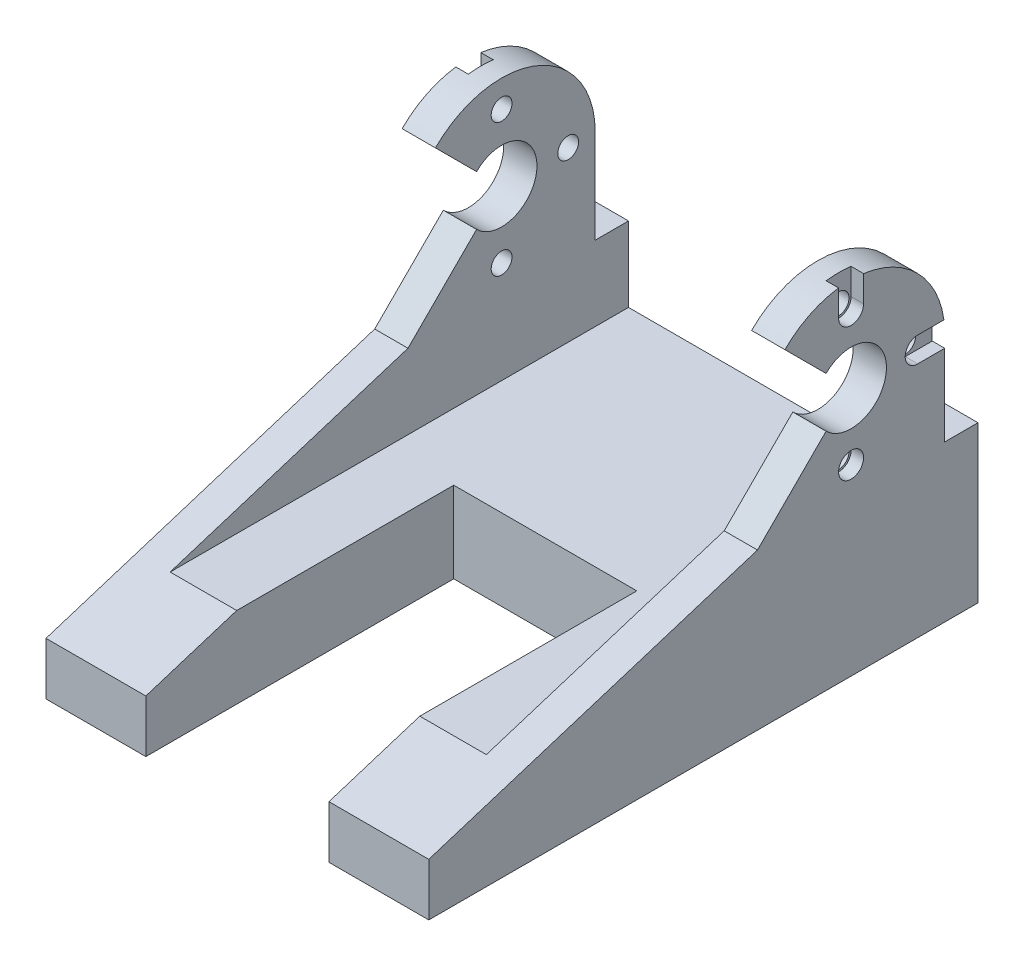
from build123d import *

# Parameters (mm, degrees)
SKETCH1_W                = 50
SKETCH1_H                = 170
BOSS_EXTRUDE1_DEPTH      = 55
SKETCH2_W                = 34
SKETCH2_H                = 27
CUT_EXTRUDE1_DEPTH       = 181.416185527
SKETCH3_W                = 10
SKETCH3_H                = 24
SKETCH3_R                = 4.25
SKETCH3_R_2              = 1
CUT_EXTRUDE2_DEPTH       = 186.539753153
SKETCH4_W                = 2
SKETCH4_H                = 24
CUT_EXTRUDE3_DEPTH       = 178.623196683
SKETCH5_W                = 6.25
SKETCH5_H                = 11.25
CUT_EXTRUDE4_DEPTH       = 186.539753153
SKETCH6_W                = 38
SKETCH6_H                = 10
CUT_EXTRUDE5_DEPTH       = 181.416185527
SKETCH8_W                = 13.25
SKETCH8_H                = 2.25
CUT_EXTRUDE7_DEPTH       = 186.539753153
SKETCH9_W                = 34
SKETCH9_H                = 35.25
CUT_EXTRUDE8_DEPTH       = 179.297679458
SKETCH11_W               = 13.25
SKETCH11_H               = 20.25
CUT_EXTRUDE9_DEPTH       = 184.480414486
SKETCH12_W               = 28.5
SKETCH12_H               = 15
BOSS_EXTRUDE2_DEPTH      = 8
SKETCH14_W               = 34
SKETCH14_H               = 15
SKETCH14_H_2             = 10.25
BOSS_EXTRUDE3_DEPTH      = 13.25
SKETCH16_R               = 4.5
SKETCH16_R_2             = 2.5
CUT_EXTRUDE13_DEPTH      = 8
SKETCH17_R               = 4.5
SKETCH17_W               = 55
SKETCH17_H               = 10.25
CUT_EXTRUDE15_DEPTH      = 175.384811552
SKETCH18_W               = 71.25
SKETCH18_H               = 27.5
SKETCH18_W_2             = 13.75
SKETCH18_W_3             = 16.25
BOSS_EXTRUDE4_DEPTH      = 50
SKETCH19_W               = 38
SKETCH19_H               = 7
CUT_EXTRUDE16_DEPTH      = 152.25227271
SKETCH20_W               = 57.5
SKETCH20_H               = 27.5
CUT_EXTRUDE17_DEPTH      = 102.137591923
CUT_EXTRUDE18_DEPTH      = 100.39221549
SKETCH22_W               = 82.5
SKETCH22_H               = 2.5
BOSS_EXTRUDE5_DEPTH      = 50
SKETCH24_W               = 22
SKETCH24_H               = 17
CUT_EXTRUDE19_DEPTH      = 101.710289941
SKETCH25_W               = 38
SKETCH25_H               = 38.136363636
CUT_EXTRUDE20_DEPTH      = 10
SKETCH27_W               = 38
SKETCH27_H               = 60.136363636
BOSS_EXTRUDE6_DEPTH      = 8.6
SKETCH29_W               = 38
SKETCH29_H               = 1.4
CUT_EXTRUDE21_DEPTH      = 85.601313414
BOSS_EXTRUDE7_DEPTH      = 50
SKETCH31_W               = 38
SKETCH31_H               = 17
CUT_EXTRUDE22_DEPTH      = 117.365802537
SKETCH32_W               = 100
SKETCH32_H               = 3
CUT_EXTRUDE23_DEPTH      = 101.710289941
SKETCH33_W               = 20
SKETCH33_H               = 10
SKETCH33_W_2             = 22
SKETCH33_H_2             = 45
CUT_EXTRUDE24_DEPTH      = 84.137311118
SKETCH34_W               = 8
SKETCH34_H               = 12
CUT_EXTRUDE25_DEPTH      = 76.0787087
BOSS_EXTRUDE8_DEPTH      = 8
SKETCH37_W               = 78
SKETCH37_H               = 9
SKETCH37_W_2             = 12
CUT_EXTRUDE27_DEPTH      = 93.48006542
FILLET1_R                = 10
CUT_EXTRUDE29_DEPTH      = 77.423572934
CUT_EXTRUDE29_DEPTH_BACK = 77.423572934
SKETCH38_W               = 2
SKETCH38_H               = 78
SKETCH38_W_2             = 46
SKETCH38_H_2             = 8
SKETCH39_W               = 22.223383748
SKETCH39_H               = 19.441332461
CUT_EXTRUDE30_DEPTH      = 86.624543794
BOSS_EXTRUDE9_DEPTH      = 0.75
CUT_EXTRUDE31_DEPTH      = 76.967920861
SKETCH44_R               = 1.25
CUT_EXTRUDE32_DEPTH      = 76.967920861
SKETCH45_R               = 1.25
SKETCH45_R_2             = 1.5
CUT_EXTRUDE33_DEPTH      = 1.5


with BuildPart() as part:
    # Sketch1 → Boss-Extrude1 (new body)
    with BuildSketch(Plane.XY):
        with Locations((0, -85)):
            Rectangle(SKETCH1_W, SKETCH1_H)
    extrude(amount=-BOSS_EXTRUDE1_DEPTH)

    # Sketch2 → Cut-Extrude1 (cut, through all)
    with BuildSketch(Plane.XY):
        with Locations((0, -13.5)):
            Rectangle(SKETCH2_W, SKETCH2_H)
    extrude(amount=-CUT_EXTRUDE1_DEPTH, mode=Mode.SUBTRACT)

    # Sketch3 → Cut-Extrude2 (cut, through all)
    with BuildSketch(Plane(origin=(25, 0, 0), x_dir=(0, 0, -1), z_dir=(1, 0, 0))):
        with Locations((50, -12)):
            Rectangle(SKETCH3_W, SKETCH3_H)
        with Locations((5, -12)):
            Rectangle(SKETCH3_W, SKETCH3_H)
        with Locations(Location((27.5, -12.75, 0), (0, 0, 90))):
            Circle(SKETCH3_R)
        with Locations(Location((35.5, -12.75, 0), (0, 0, 90))):
            Circle(SKETCH3_R_2)
        with Locations(Location((27.5, -4.75, 0), (0, 0, 90))):
            Circle(SKETCH3_R_2)
        with Locations(Location((27.5, -20.75, 0), (0, 0, 90))):
            Circle(SKETCH3_R_2)
        with Locations(Location((19.5, -12.75, 0), (0, 0, 90))):
            Circle(SKETCH3_R_2)
    extrude(amount=-CUT_EXTRUDE2_DEPTH, mode=Mode.SUBTRACT)

    # Sketch4 → Cut-Extrude3 (cut, through all)
    with BuildSketch(Plane.XY.offset(-10)):
        with Locations((-18, -12)):
            Rectangle(SKETCH4_W, SKETCH4_H)
        with Locations((18, -12)):
            Rectangle(SKETCH4_W, SKETCH4_H)
    extrude(amount=-CUT_EXTRUDE3_DEPTH, mode=Mode.SUBTRACT)

    # Sketch5 → Cut-Extrude4 (cut, through all)
    with BuildSketch(Plane(origin=(25, 0, 0), x_dir=(0, 0, -1), z_dir=(1, 0, 0))):
        with BuildLine():
            Line((45, 0), (10, 0))
            Line((10, 0), (10, -12.75))
            Line((10, -12.75), (16.25, -12.75))
            ThreePointArc((16.25, -12.75), (27.5, -1.5), (38.75, -12.75))
            Line((38.75, -12.75), (45, -12.75))
            Line((45, -12.75), (45, 0))
        make_face()
        with Locations((13.125, -18.375)):
            Rectangle(SKETCH5_W, SKETCH5_H)
        with Locations((41.875, -18.375)):
            Rectangle(SKETCH5_W, SKETCH5_H)
    extrude(amount=-CUT_EXTRUDE4_DEPTH, mode=Mode.SUBTRACT)

    # Sketch6 → Cut-Extrude5 (cut, through all)
    with BuildSketch(Plane.XY):
        with Locations((0, -29)):
            Rectangle(SKETCH6_W, SKETCH6_H)
    extrude(amount=-CUT_EXTRUDE5_DEPTH, mode=Mode.SUBTRACT)

    # Sketch8 → Cut-Extrude7 (cut, through all)
    with BuildSketch(Plane(origin=(25, 0, 0), x_dir=(0, 0, -1), z_dir=(1, 0, 0))):
        with BuildLine():
            Line((27.5, -157.5), (27.5, -132.5))
            Line((27.5, -132.5), (13.25, -132.5))
            Line((13.25, -132.5), (13.25, -167.75))
            Line((13.25, -167.75), (17.25, -167.75))
            ThreePointArc((17.25, -167.75), (20.252155493, -160.502155493), (27.5, -157.5))
        make_face()
        with BuildLine():
            Line((41.75, -167.75), (41.75, -132.5))
            Line((41.75, -132.5), (27.5, -132.5))
            Line((27.5, -132.5), (27.5, -157.5))
            ThreePointArc((27.5, -157.5), (34.747844507, -160.502155493), (37.75, -167.75))
            Line((37.75, -167.75), (41.75, -167.75))
        make_face()
        with Locations((48.375, -168.875)):
            Rectangle(SKETCH8_W, SKETCH8_H)
        with Locations((6.625, -168.875)):
            Rectangle(SKETCH8_W, SKETCH8_H)
        with BuildLine():
            Line((17.25, -167.75), (13.25, -167.75))
            Line((13.25, -167.75), (13.25, -170))
            Line((13.25, -170), (17.5, -170))
            ThreePointArc((17.5, -170), (17.31269172, -168.881923142), (17.25, -167.75))
        make_face()
        with BuildLine():
            Line((41.75, -170), (41.75, -167.75))
            Line((41.75, -167.75), (37.75, -167.75))
            ThreePointArc((37.75, -167.75), (37.68730828, -168.881923142), (37.5, -170))
            Line((37.5, -170), (41.75, -170))
        make_face()
        with BuildLine():
            Line((27.5, -167.75), (27.5, -157.5))
            ThreePointArc((27.5, -157.5), (20.252155493, -160.502155493), (17.25, -167.75))
            Line((17.25, -167.75), (27.5, -167.75))
        make_face()
        with BuildLine():
            ThreePointArc((37.75, -167.75), (34.747844507, -160.502155493), (27.5, -157.5))
            Line((27.5, -157.5), (27.5, -167.75))
            Line((27.5, -167.75), (37.75, -167.75))
        make_face()
        with BuildLine():
            Line((27.5, -170), (27.5, -167.75))
            Line((27.5, -167.75), (17.25, -167.75))
            ThreePointArc((17.25, -167.75), (17.31269172, -168.881923142), (17.5, -170))
            Line((17.5, -170), (27.5, -170))
        make_face()
        with BuildLine():
            ThreePointArc((37.5, -170), (37.68730828, -168.881923142), (37.75, -167.75))
            Line((37.75, -167.75), (27.5, -167.75))
            Line((27.5, -167.75), (27.5, -170))
            Line((27.5, -170), (37.5, -170))
        make_face()
    extrude(amount=-CUT_EXTRUDE7_DEPTH, mode=Mode.SUBTRACT)

    # Sketch9 → Cut-Extrude8 (cut, through all)
    with BuildSketch(Plane.XY):
        with Locations((0, -150.125)):
            Rectangle(SKETCH9_W, SKETCH9_H)
    extrude(amount=-CUT_EXTRUDE8_DEPTH, mode=Mode.SUBTRACT)

    # Sketch11 → Cut-Extrude9 (cut, through all)
    with BuildSketch(Plane(origin=(25, 0, 0), x_dir=(0, 0, -1), z_dir=(1, 0, 0))):
        with BuildLine():
            ThreePointArc((17.25, -167.75), (20.252155493, -160.502155493), (27.5, -157.5))
            Line((27.5, -157.5), (27.5, -147.5))
            Line((27.5, -147.5), (13.25, -147.5))
            Line((13.25, -147.5), (13.25, -167.75))
            Line((13.25, -167.75), (17.25, -167.75))
        make_face()
        with BuildLine():
            Line((27.5, -147.5), (27.5, -157.5))
            ThreePointArc((27.5, -157.5), (34.747844507, -160.502155493), (37.75, -167.75))
            Line((37.75, -167.75), (41.75, -167.75))
            Line((41.75, -167.75), (41.75, -147.5))
            Line((41.75, -147.5), (27.5, -147.5))
        make_face()
        with Locations((48.375, -157.625)):
            Rectangle(SKETCH11_W, SKETCH11_H)
        with Locations((6.625, -157.625)):
            Rectangle(SKETCH11_W, SKETCH11_H)
    extrude(amount=-CUT_EXTRUDE9_DEPTH, mode=Mode.SUBTRACT)

    # Sketch12 → Boss-Extrude2 (add)
    with BuildSketch(Plane(origin=(25, 0, 0), x_dir=(0, 0, -1), z_dir=(1, 0, 0))):
        with Locations((27.5, -140)):
            Rectangle(SKETCH12_W, SKETCH12_H)
    boss_extrude2 = extrude(amount=-BOSS_EXTRUDE2_DEPTH)

    # Mirror1: Boss-Extrude2 across plane
    add(boss_extrude2.mirror(Plane(origin=(0, 0, 0), x_dir=(0, 0, 1), z_dir=(1, 0, 0))))

    # Sketch14 → Boss-Extrude3 (add)
    with BuildSketch(Plane.XY):
        with Locations((0, -140)):
            Rectangle(SKETCH14_W, SKETCH14_H)
        with Locations((0, -152.625)):
            Rectangle(SKETCH14_W, SKETCH14_H_2)
    boss_extrude3 = extrude(amount=-BOSS_EXTRUDE3_DEPTH)

    # Mirror2: Boss-Extrude3 across plane
    add(boss_extrude3.mirror(Plane.XY.offset(-27.5)))

    # Sketch16 → Cut-Extrude13 (cut)
    # profile 1 of 3: a face of its own
    with BuildSketch(Plane(origin=(25, 0, 0), x_dir=(0, 0, -1), z_dir=(1, 0, 0))):
        with Locations(Location((16.5, -135.75, 0), (0, 0, 90))):
            Circle(SKETCH16_R)
        with Locations((16.5, -135.75)):
            Circle(SKETCH16_R_2, mode=Mode.SUBTRACT)
    # profile 2 of 3: a face of its own
    with BuildSketch(Plane(origin=(25, 0, 0), x_dir=(0, 0, -1), z_dir=(1, 0, 0))):
        with Locations((16.5, -135.75)):
            Circle(SKETCH16_R_2)
    # profile 3 of 3: a face of its own
    with BuildSketch(Plane(origin=(25, 0, 0), x_dir=(0, 0, -1), z_dir=(1, 0, 0))):
        with Locations(Location((38.5, -135.75, 0), (0, 0, 90))):
            Circle(SKETCH16_R)
    cut_extrude13 = extrude(amount=-CUT_EXTRUDE13_DEPTH, mode=Mode.SUBTRACT)

    # Mirror3: Cut-Extrude13 across plane
    add(cut_extrude13.mirror(Plane(origin=(0, 0, 0), x_dir=(0, 0, 1), z_dir=(1, 0, 0))), mode=Mode.SUBTRACT)

    # Sketch17 → Cut-Extrude15 (cut, through all)
    # profile 1 of 4: a face of its own
    with BuildSketch(Plane(origin=(25, 0, 0), x_dir=(0, 0, -1), z_dir=(1, 0, 0))):
        Polygon((55, -51.5), (27.5, -51.5), (0, -51.5), (0, -147.5), (55, -147.5), align=None)
        with Locations((16.5, -135.75)):
            Circle(SKETCH17_R, mode=Mode.SUBTRACT)
        with Locations((38.5, -135.75)):
            Circle(SKETCH17_R, mode=Mode.SUBTRACT)
    # profile 2 of 4: a face of its own
    with BuildSketch(Plane(origin=(25, 0, 0), x_dir=(0, 0, -1), z_dir=(1, 0, 0))):
        with Locations((27.5, -152.625)):
            Rectangle(SKETCH17_W, SKETCH17_H)
    # profile 3 of 4: a face of its own
    with BuildSketch(Plane(origin=(25, 0, 0), x_dir=(0, 0, -1), z_dir=(1, 0, 0))):
        with Locations((38.5, -135.75)):
            Circle(SKETCH17_R)
    # profile 4 of 4: a face of its own
    with BuildSketch(Plane(origin=(25, 0, 0), x_dir=(0, 0, -1), z_dir=(1, 0, 0))):
        with Locations((16.5, -135.75)):
            Circle(SKETCH17_R)
    extrude(amount=-CUT_EXTRUDE15_DEPTH, mode=Mode.SUBTRACT)

    # Sketch18 → Boss-Extrude4 (add)
    with BuildSketch(Plane(origin=(25, 0, 0), x_dir=(0, 0, -1), z_dir=(1, 0, 0))):
        with Locations((-35.625, -37.75)):
            Rectangle(SKETCH18_W, SKETCH18_H)
        with Locations((61.875, -37.75)):
            Rectangle(SKETCH18_W_2, SKETCH18_H)
        Polygon((38.75, -51.5), (38.75, -24), (16.25, -24), (0, -24), (0, -51.5), align=None)
        with Locations((46.875, -37.75)):
            Rectangle(SKETCH18_W_3, SKETCH18_H)
    extrude(amount=-BOSS_EXTRUDE4_DEPTH)

    # Sketch19 → Cut-Extrude16 (cut, through all)
    with BuildSketch(Plane.XY.offset(71.25)):
        with Locations((0, -27.5)):
            Rectangle(SKETCH19_W, SKETCH19_H)
    extrude(amount=-CUT_EXTRUDE16_DEPTH, mode=Mode.SUBTRACT)

    # Sketch20 → Cut-Extrude17 (cut, through all)
    with BuildSketch(Plane(origin=(25, 0, 0), x_dir=(0, 0, -1), z_dir=(1, 0, 0))):
        with Locations((-42.5, -37.75)):
            Rectangle(SKETCH20_W, SKETCH20_H)
    extrude(amount=-CUT_EXTRUDE17_DEPTH, mode=Mode.SUBTRACT)

    # Sketch21 → Cut-Extrude18 (cut, through all)
    with BuildSketch(Plane(origin=(25, 0, 0), x_dir=(0, 0, -1), z_dir=(1, 0, 0))):
        Polygon((16.25, -24), (-13.75, -51.5), (-13.75, -24), align=None)
    extrude(amount=-CUT_EXTRUDE18_DEPTH, mode=Mode.SUBTRACT)

    # Sketch22 → Boss-Extrude5 (add)
    with BuildSketch(Plane(origin=(25, 0, 0), x_dir=(0, 0, -1), z_dir=(1, 0, 0))):
        with Locations((27.5, -52.75)):
            Rectangle(SKETCH22_W, SKETCH22_H)
    extrude(amount=-BOSS_EXTRUDE5_DEPTH)

    # Sketch24 → Cut-Extrude19 (cut, through all)
    with BuildSketch(Plane(origin=(25, 0, 0), x_dir=(0, 0, -1), z_dir=(1, 0, 0))):
        with Locations((57.75, -32.5)):
            Rectangle(SKETCH24_W, SKETCH24_H)
    extrude(amount=-CUT_EXTRUDE19_DEPTH, mode=Mode.SUBTRACT)

    # Sketch25 → Cut-Extrude20 (cut)
    with BuildSketch(Plane(origin=(0, -31, 0), x_dir=(1, 0, 0), z_dir=(0, 1, 0))):
        with Locations((0, 27.681818182)):
            Rectangle(SKETCH25_W, SKETCH25_H)
    extrude(amount=-CUT_EXTRUDE20_DEPTH, mode=Mode.SUBTRACT)

    # Sketch27 → Boss-Extrude6 (add)
    with BuildSketch(Plane(origin=(0, -41, 0), x_dir=(1, 0, 0), z_dir=(0, 1, 0))):
        with Locations((0, 38.681818182)):
            Rectangle(SKETCH27_W, SKETCH27_H)
    extrude(amount=BOSS_EXTRUDE6_DEPTH)

    # Sketch29 → Cut-Extrude21 (cut, through all)
    with BuildSketch(Plane(origin=(0, 0, -8.613636364), x_dir=(-1, 0, 0), z_dir=(0, 0, -1))):
        with Locations((0, -31.7)):
            Rectangle(SKETCH29_W, SKETCH29_H)
    extrude(amount=-CUT_EXTRUDE21_DEPTH, mode=Mode.SUBTRACT)

    # Sketch30 → Boss-Extrude7 (add)
    with BuildSketch(Plane.ZY.offset(25)):
        Polygon((31.25, -38.957214173), (-16.25, -24), (-7.086363636, -32.4), (13.75, -51.5), (13.75, -53.914428346), (31.25, -53.914428346), align=None)
        Polygon((-16.25, -24), (-16.25, -32.4), (-7.086363636, -32.4), align=None)
    extrude(amount=-BOSS_EXTRUDE7_DEPTH)

    # Sketch31 → Cut-Extrude22 (cut, through all)
    with BuildSketch(Plane(origin=(0, 0, -68.75), x_dir=(-1, 0, 0), z_dir=(0, 0, -1))):
        with Locations((0, -32.5)):
            Rectangle(SKETCH31_W, SKETCH31_H)
    extrude(amount=-CUT_EXTRUDE22_DEPTH, mode=Mode.SUBTRACT)

    # Sketch32 → Cut-Extrude23 (cut, through all)
    with BuildSketch(Plane(origin=(25, 0, 0), x_dir=(0, 0, -1), z_dir=(1, 0, 0))):
        with Locations((18.75, -52.5)):
            Rectangle(SKETCH32_W, SKETCH32_H)
    extrude(amount=-CUT_EXTRUDE23_DEPTH, mode=Mode.SUBTRACT)

    # Sketch33 → Cut-Extrude24 (cut, through all)
    with BuildSketch(Plane(origin=(0, -41, 0), x_dir=(1, 0, 0), z_dir=(0, 1, 0))):
        Polygon((-10, 68.75), (-25, 68.75), (-25, 46.75), (-19, 46.75), (-10, 46.75), (-10, 58.75), align=None)
        Polygon((25, 68.75), (10, 68.75), (10, 58.75), (10, 46.75), (19, 46.75), (25, 46.75), align=None)
        with Locations((0, 63.75)):
            Rectangle(SKETCH33_W, SKETCH33_H)
        with Locations((0, -8.75)):
            Rectangle(SKETCH33_W_2, SKETCH33_H_2)
    extrude(amount=-CUT_EXTRUDE24_DEPTH, mode=Mode.SUBTRACT)

    # Sketch34 → Cut-Extrude25 (cut, through all)
    with BuildSketch(Plane(origin=(0, -41, 0), x_dir=(1, 0, 0), z_dir=(0, 1, 0))):
        with Locations((0, 52.75)):
            Rectangle(SKETCH34_W, SKETCH34_H)
    extrude(amount=-CUT_EXTRUDE25_DEPTH, mode=Mode.SUBTRACT)

    # Sketch36 → Boss-Extrude8 (add)
    with BuildSketch(Plane(origin=(0, -41, 0), x_dir=(1, 0, 0), z_dir=(0, 1, 0))):
        Polygon((4, 58.75), (4, 46.75), (-4, 46.75), (-4, 58.75), (-10, 58.75), (-10, 46.75), (-19, 46.75), (-19, -31.25), (-11, -31.25), (-11, 13.75), (11, 13.75), (11, -31.25), (19, -31.25), (19, 46.75), (10, 46.75), (10, 58.75), align=None)
    extrude(amount=BOSS_EXTRUDE8_DEPTH)

    # Sketch37 → Cut-Extrude27 (cut, through all)
    with BuildSketch(Plane(origin=(25, 0, 0), x_dir=(0, 0, -1), z_dir=(1, 0, 0))):
        with Locations((7.75, -46.5)):
            Rectangle(SKETCH37_W, SKETCH37_H)
        Polygon((-31.25, -33), (-31.25, -38.957214173), (-12.331525614, -33), align=None)
        with Locations((52.75, -46.5)):
            Rectangle(SKETCH37_W_2, SKETCH37_H)
    extrude(amount=-CUT_EXTRUDE27_DEPTH, mode=Mode.SUBTRACT)

    # Fillet1
    # the kernel refuses this fillet: 10 mm, written as the material it takes off along each edge
    with BuildSketch(Plane(origin=(20.874685928, -42, -58.75), x_dir=(0, 0, 1), z_dir=(-1, 0, 0)), Plane(origin=(34.874685928, -42, -58.75), x_dir=(0, 0, 1), z_dir=(-1, 0, 0))) as fillet1_piece_1:
        with BuildLine():
            CenterArc((9.949874371, 10), FILLET1_R, 185.739170477, 84.260829523)
            Line((0, 9), (-0.198997487, 8.98))
            ThreePointArc((-0.198997487, 8.98), (-0.2, 4.5), (-0.2, 0))
            Line((-0.2, 0), (0, -0.2))
            Line((0, -0.2), (9.949874371, -0.2))
            Line((9.949874371, -0.2), (9.949874371, 0))
        make_face()
    extrude(amount=55.749371855, mode=Mode.SUBTRACT)

    # Sketch38 → Cut-Extrude29 (cut, two sides: drawn at the far end of the back side and taken through both)
    with BuildSketch(Plane(origin=(0, 0, 0), x_dir=(1, 0, 0), z_dir=(0, 1, 0)).offset(-CUT_EXTRUDE29_DEPTH_BACK)):
        with Locations((-24, 7.75)):
            Rectangle(SKETCH38_W, SKETCH38_H)
        with Locations((24, 7.75)):
            Rectangle(SKETCH38_W, SKETCH38_H)
        with Locations((0, -27.25)):
            Rectangle(SKETCH38_W_2, SKETCH38_H_2)
    extrude(amount=CUT_EXTRUDE29_DEPTH + CUT_EXTRUDE29_DEPTH_BACK, mode=Mode.SUBTRACT)

    # Sketch39 → Cut-Extrude30 (cut, through all)
    with BuildSketch(Plane(origin=(23, 0, 0), x_dir=(0, 0, -1), z_dir=(1, 0, 0))):
        with Locations((53.861691874, -33.720666231)):
            Rectangle(SKETCH39_W, SKETCH39_H)
    extrude(amount=-CUT_EXTRUDE30_DEPTH, mode=Mode.SUBTRACT)

    # Sketch41 → Boss-Extrude9 (add)
    with BuildSketch(Plane.XZ.offset(42)):
        Polygon((-11, 23.25), (-23, 23.25), (-23, -42.75), (23, -42.75), (23, 23.25), (11, 23.25), (11, -13.75), (-11, -13.75), align=None)
    extrude(amount=BOSS_EXTRUDE9_DEPTH)

    # Sketch42 → Cut-Extrude31 (cut, through all)
    with BuildSketch(Plane(origin=(23, 0, 0), x_dir=(0, 0, -1), z_dir=(1, 0, 0))):
        Polygon((16.25, -24), (27.5, -12.75), (19.545048712, -4.795048712), (8.295048712, -16.045048712), align=None)
    extrude(amount=-CUT_EXTRUDE31_DEPTH, mode=Mode.SUBTRACT)

    # Sketch44 → Cut-Extrude32 (cut, through all)
    with BuildSketch(Plane(origin=(23, 0, 0), x_dir=(0, 0, -1), z_dir=(1, 0, 0))):
        with Locations((27.5, -4.75)):
            Circle(SKETCH44_R)
        with Locations((35.5, -12.75)):
            Circle(SKETCH44_R)
        with Locations((27.5, -20.75)):
            Circle(SKETCH44_R)
    extrude(amount=-CUT_EXTRUDE32_DEPTH, mode=Mode.SUBTRACT)

    # Sketch45 → Cut-Extrude33 (cut)
    # profile 1 of 3: a face of its own
    with BuildSketch(Plane(origin=(23, 0, 0), x_dir=(0, 0, -1), z_dir=(1, 0, 0))):
        with BuildLine():
            Line((29, -4.75), (29, -1.60044844))
            ThreePointArc((29, -1.60044844), (27.5, -1.5), (26, -1.60044844))
            Line((26, -1.60044844), (26, -4.75))
            ThreePointArc((26, -4.75), (27.5, -6.25), (29, -4.75))
        make_face()
        with Locations((27.5, -4.75)):
            Circle(SKETCH45_R, mode=Mode.SUBTRACT)
    # profile 2 of 3: a face of its own
    with BuildSketch(Plane(origin=(23, 0, 0), x_dir=(0, 0, -1), z_dir=(1, 0, 0))):
        with BuildLine():
            ThreePointArc((38.75, -12.75), (38.7248598, -11.998320233), (38.64955156, -11.25))
            Line((38.64955156, -11.25), (35.5, -11.25))
            ThreePointArc((35.5, -11.25), (34, -12.75), (35.5, -14.25))
            Line((35.5, -14.25), (38.75, -14.25))
            Line((38.75, -14.25), (38.75, -12.75))
        make_face()
        with Locations((35.5, -12.75)):
            Circle(SKETCH45_R, mode=Mode.SUBTRACT)
    # profile 3 of 3: a face of its own
    with BuildSketch(Plane(origin=(23, 0, 0), x_dir=(0, 0, -1), z_dir=(1, 0, 0))):
        with Locations((27.5, -20.75)):
            Circle(SKETCH45_R_2)
        with Locations((27.5, -20.75)):
            Circle(SKETCH45_R, mode=Mode.SUBTRACT)
    cut_extrude33 = extrude(amount=-CUT_EXTRUDE33_DEPTH, mode=Mode.SUBTRACT)

    # Mirror4: Cut-Extrude33 across plane
    add(cut_extrude33.mirror(Plane(origin=(0, 0, 0), x_dir=(0, 0, 1), z_dir=(1, 0, 0))), mode=Mode.SUBTRACT)


solid = part.part
